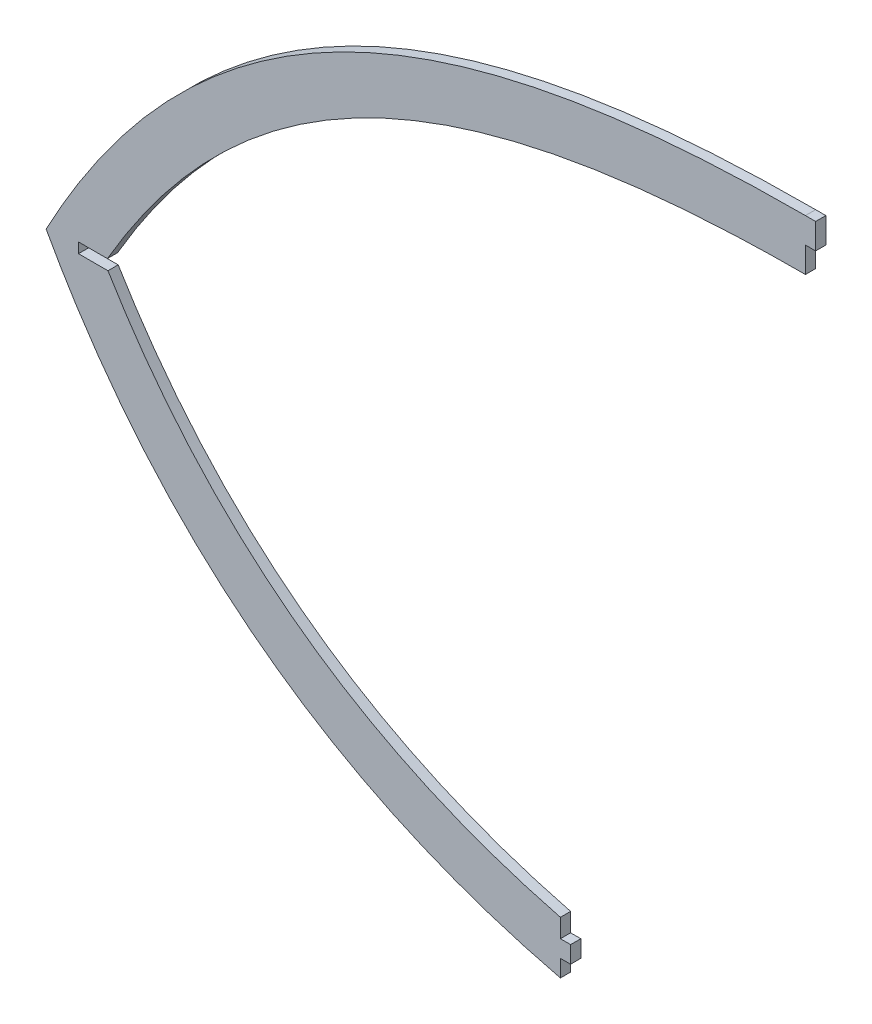
from build123d import *

# Parameters (mm, degrees)
BOSS_EXTRUDE1_DEPTH = 1.5


with BuildPart() as part:
    # Sketch1 → Boss-Extrude1 (new, symmetric)
    with BuildSketch(Plane.XY):
        with BuildLine():
            Line((-83, 153), (-80, 153))
            Line((-80, 153), (-80, 160.5))
            Line((-80, 160.5), (-83, 160.5))
            add(Edge.make_bspline(
                [(-83, 160.5), (-186.674882328, 160.5), (-259.899625943, 132.369993049), (-306.089272366, 45.5)],
                knots=[0, 0, 0, 0, 1, 1, 1, 1], degree=3))
            add(Edge.make_bspline(
                [(-155, -69.5), (-256.223953913, -45.186386925), (-306.089272366, 45.5)],
                knots=[0, 0, 0, 1, 1, 1], degree=2))
            Line((-155, -69.5), (-155, -64.5))
            Line((-155, -64.5), (-152, -64.5))
            Line((-152, -64.5), (-152, -59.5))
            Line((-152, -59.5), (-155, -59.5))
            Line((-155, -59.5), (-155, -54.048230826))
            add(Edge.make_bspline(
                [(-155, -54.048230826), (-155.731391072, -53.861952542), (-158.353006117, -53.182510153), (-164.660079812, -51.441937103), (-173.748401065, -48.593950888), (-184.269254843, -44.741272938), (-197.799811005, -39.023974285), (-213.789585617, -30.792816144), (-231.54938628, -19.175615564), (-247.929147797, -5.797107699), (-260.461993531, 6.849243634), (-269.830689916, 17.887635578), (-276.528905481, 26.631356249), (-281.840565627, 34.314662243), (-285.585788565, 40.167039771), (-287.259111537, 42.898020189), (-287.922750115, 44.000000102)],
                knots=[0.497752743, 0.497752743, 0.497752743, 0.497752743, 0.497805621, 0.497942734, 0.498216959, 0.498491185, 0.49876541, 0.499313861, 0.499862311, 0.500410762, 0.500959213, 0.501233438, 0.501507663, 0.501781889, 0.501919001, 0.502011047, 0.502011047, 0.502011047, 0.502011047], degree=3))
            Line((-287.922750115, 44.000000102), (-296.595237141, 44))
            Line((-296.595237141, 44), (-296.595237141, 47))
            Line((-296.595237141, 47), (-288.095237155, 46.999999977))
            add(Edge.make_bspline(
                [(-288.095237155, 46.999999977), (-287.67425608, 47.723773029), (-286.556391538, 49.623615877), (-284.033138295, 53.780945514), (-280.456261147, 59.345240484), (-276.041179686, 65.705065743), (-269.986302057, 73.779240653), (-262.103210513, 83.128273836), (-252.129600389, 93.224723366), (-241.623487548, 102.265543316), (-226.8699821, 112.996693644), (-206.95054411, 124.077334491), (-184.837162494, 132.347816663), (-165.731643324, 137.402287642), (-150.68126183, 140.438776977), (-134.89929995, 142.748064465), (-121.133672011, 144.089727596), (-109.75100783, 144.828269011), (-101.030097883, 145.218689511), (-93.605076071, 145.411132847), (-87.580198375, 145.487405992), (-84.523017423, 145.5), (-83, 145.5)],
                knots=[0.005881872, 0.005881872, 0.005881872, 0.005881872, 0.01516131, 0.03032262, 0.060645241, 0.090967861, 0.121290481, 0.181935722, 0.242580962, 0.303226203, 0.363871444, 0.485161925, 0.606452406, 0.667097647, 0.727742887, 0.788388128, 0.849033368, 0.879355989, 0.909678609, 0.940001229, 0.955162539, 0.97032385, 0.97032385, 0.97032385, 0.97032385], degree=3))
            Line((-83, 145.5), (-83, 153))
        make_face()
    extrude(amount=BOSS_EXTRUDE1_DEPTH, both=True)


solid = part.part
